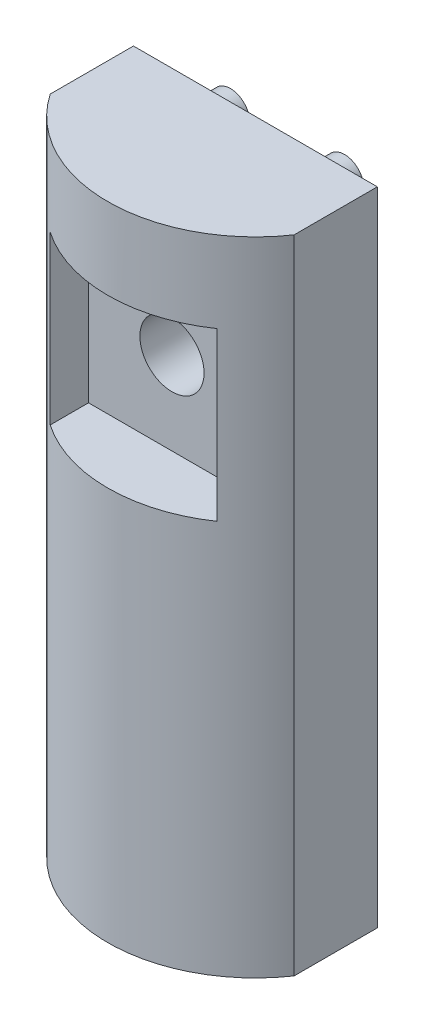
from build123d import *

# Parameters (mm, degrees)
EXTRUDE_1_DEPTH     = 100
SKETCH_2_R          = 3
SKETCH_2_R_2        = 0.9
EXTRUDE_2_DEPTH     = 5
SKETCH_4_W          = 66.593168222
SKETCH_4_H          = 122.189299492
SKETCH_4_W_2        = 38
SKETCH_4_H_2        = 100
CUT_EXTRUDE_1_DEPTH = 106.157025443
CUT_EXTRUDE_START   = -23
SKETCH_5_W          = 26
SKETCH_5_H          = 26
CUT_EXTRUDE_2_DEPTH = 10
SKETCH_6_R          = 5
CUT_EXTRUDE_3_DEPTH = 32


with BuildPart() as part:
    # Эскиз1 → Бобышка-Вытянуть1 (new body)
    with BuildSketch(Plane(origin=(0, 0, 0), x_dir=(1, 0, 0), z_dir=(0, 1, 0))):
        with BuildLine():
            Line((-23, 0), (23, 0))
            ThreePointArc((23, 0), (0, -23), (-23, 0))
        make_face()
    extrude(amount=EXTRUDE_1_DEPTH)

    # Эскиз2 → Бобышка-Вытянуть2 (add)
    # profile 1 of 4: a face of its own
    with BuildSketch(Plane(origin=(0, 0, 0), x_dir=(-1, 0, 0), z_dir=(0, 0, -1))):
        with Locations((-8.89, 93.815)):
            Circle(SKETCH_2_R)
        with Locations((-8.89, 93.815)):
            Circle(SKETCH_2_R_2, mode=Mode.SUBTRACT)
    # profile 2 of 4: a face of its own
    with BuildSketch(Plane(origin=(0, 0, 0), x_dir=(-1, 0, 0), z_dir=(0, 0, -1))):
        with Locations((8.89, 93.815)):
            Circle(SKETCH_2_R)
        with Locations((8.89, 93.815)):
            Circle(SKETCH_2_R_2, mode=Mode.SUBTRACT)
    # profile 3 of 4: a face of its own
    with BuildSketch(Plane(origin=(0, 0, 0), x_dir=(-1, 0, 0), z_dir=(0, 0, -1))):
        with Locations((-8.89, 6.185)):
            Circle(SKETCH_2_R)
        with Locations((-8.89, 6.185)):
            Circle(SKETCH_2_R_2, mode=Mode.SUBTRACT)
    # profile 4 of 4: a face of its own
    with BuildSketch(Plane(origin=(0, 0, 0), x_dir=(-1, 0, 0), z_dir=(0, 0, -1))):
        with Locations((8.89, 6.185)):
            Circle(SKETCH_2_R)
        with Locations((8.89, 6.185)):
            Circle(SKETCH_2_R_2, mode=Mode.SUBTRACT)
    extrude(amount=EXTRUDE_2_DEPTH)

    # Эскиз4 → Вырез-Вытянуть1 (cut, through all)
    with BuildSketch(Plane(origin=(0, 0, 0), x_dir=(-1, 0, 0), z_dir=(0, 0, -1))):
        with Locations((0, 49.541790127)):
            Rectangle(SKETCH_4_W, SKETCH_4_H)
        with Locations((0, 50)):
            Rectangle(SKETCH_4_W_2, SKETCH_4_H_2, mode=Mode.SUBTRACT)
    extrude(amount=-CUT_EXTRUDE_1_DEPTH, mode=Mode.SUBTRACT)

    # Эскиз5 → Вырез-Вытянуть2 (cut)
    with BuildSketch(Plane(origin=(0, 0, 0), x_dir=(-1, 0, 0), z_dir=(0, 0, -1)).offset(CUT_EXTRUDE_START)):
        with Locations((0, 74.350689365)):
            Rectangle(SKETCH_5_W, SKETCH_5_H)
    extrude(amount=CUT_EXTRUDE_2_DEPTH, mode=Mode.SUBTRACT)

    # Эскиз6 → Вырез-Вытянуть3 (cut)
    with BuildSketch(Plane.XY.offset(13)):
        with Locations((0, 74.350689365)):
            Circle(SKETCH_6_R)
    extrude(amount=-CUT_EXTRUDE_3_DEPTH, mode=Mode.SUBTRACT)


solid = part.part
